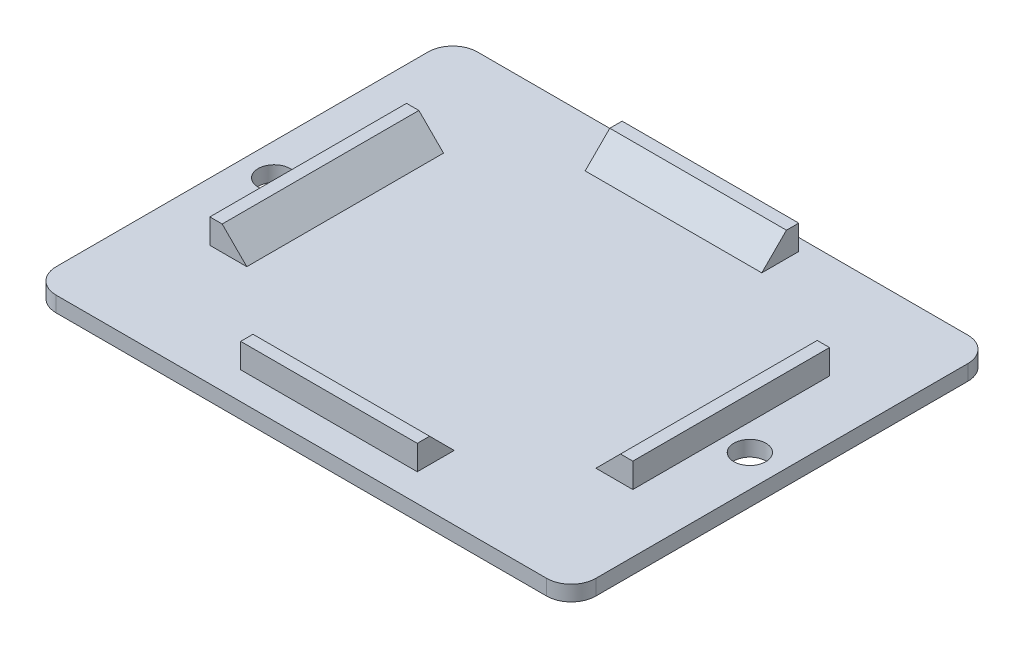
from build123d import *

# Parameters (mm, degrees)
SKETCH1_W           = 56.6674
SKETCH1_H           = 44.45
BOSS_EXTRUDE1_DEPTH = 1.5875
SKETCH2_W           = 43.6118
SKETCH2_H           = 39.3319
SKETCH2_W_2         = 41.0718
SKETCH2_H_2         = 36.7919
BOSS_EXTRUDE2_DEPTH = 2.54
SKETCH3_R           = 1.651
CUT_EXTRUDE1_DEPTH  = 37.099872308
SKETCH4_W           = 56.6674
SKETCH4_H           = 44.45
SKETCH4_W_2         = 55.6514
SKETCH4_H_2         = 43.434
CUT_EXTRUDE2_DEPTH  = 37.099872308
FILLET1_R           = 2.54
SKETCH5_W           = 12.7
SKETCH5_H           = 9.525
CUT_EXTRUDE3_DEPTH  = 36.388547151
CHAMFER1_SIZE       = 2.54


with BuildPart() as part:
    # Sketch1 → Boss-Extrude1 (new body)
    with BuildSketch(Plane(origin=(0, 0, 0), x_dir=(1, 0, 0), z_dir=(0, 1, 0))):
        Rectangle(SKETCH1_W, SKETCH1_H)
    extrude(amount=BOSS_EXTRUDE1_DEPTH)

    # Sketch2 → Boss-Extrude2 (add)
    with BuildSketch(Plane(origin=(0, 1.5875, 0), x_dir=(1, 0, 0), z_dir=(0, 1, 0))):
        with Locations((0, 0.79375)):
            Rectangle(SKETCH2_W, SKETCH2_H)
        with Locations((0, 0.79375)):
            Rectangle(SKETCH2_W_2, SKETCH2_H_2, mode=Mode.SUBTRACT)
    extrude(amount=BOSS_EXTRUDE2_DEPTH)

    # Sketch3 → Cut-Extrude1 (cut, through all)
    with BuildSketch(Plane(origin=(0, 1.5875, 0), x_dir=(1, 0, 0), z_dir=(0, 1, 0))):
        with Locations(Location((-24.5237, 0, 0), (0, 0, 270))):
            Circle(SKETCH3_R)
        with Locations(Location((24.5237, 0, 0), (0, 0, 270))):
            Circle(SKETCH3_R)
    extrude(amount=-CUT_EXTRUDE1_DEPTH, mode=Mode.SUBTRACT)

    # Sketch4 → Cut-Extrude2 (cut, through all)
    with BuildSketch(Plane(origin=(0, 1.5875, 0), x_dir=(1, 0, 0), z_dir=(0, 1, 0))):
        Rectangle(SKETCH4_W, SKETCH4_H)
        Rectangle(SKETCH4_W_2, SKETCH4_H_2, mode=Mode.SUBTRACT)
    extrude(amount=-CUT_EXTRUDE2_DEPTH, mode=Mode.SUBTRACT)

    # Fillet1
    fillet1_edges = [part.edges().sort_by_distance(p)[0] for p in [
        (27.8257, 0.79375, 21.717),
        (-27.8257, 0.79375, 21.717),
        (-27.8257, 0.79375, -21.717),
        (27.8257, 0.79375, -21.717),
    ]]
    fillet(fillet1_edges, radius=FILLET1_R)

    # Sketch5 → Cut-Extrude3 (cut, through all)
    with BuildSketch(Plane(origin=(0, 1.5875, 0), x_dir=(1, 0, 0), z_dir=(0, 1, 0))):
        with Locations((-15.4559, 15.6972)):
            Rectangle(SKETCH5_W, SKETCH5_H)
        with Locations((-15.4559, -14.1097)):
            Rectangle(SKETCH5_W, SKETCH5_H)
        with Locations((15.4559, -14.1097)):
            Rectangle(SKETCH5_W, SKETCH5_H)
        with Locations((15.4559, 15.6972)):
            Rectangle(SKETCH5_W, SKETCH5_H)
    extrude(amount=CUT_EXTRUDE3_DEPTH, mode=Mode.SUBTRACT)

    # Chamfer1
    chamfer1_edges = [part.edges().sort_by_distance(p)[0] for p in [
        (0, 1.5875, 17.6022),
        (20.5359, 1.5875, -0.79375),
        (0, 1.5875, -19.1897),
        (-20.5359, 1.5875, -0.79375),
    ]]
    chamfer(chamfer1_edges, length=CHAMFER1_SIZE - 0.0001)  # a hair under: the kernel refuses the full size


solid = part.part
